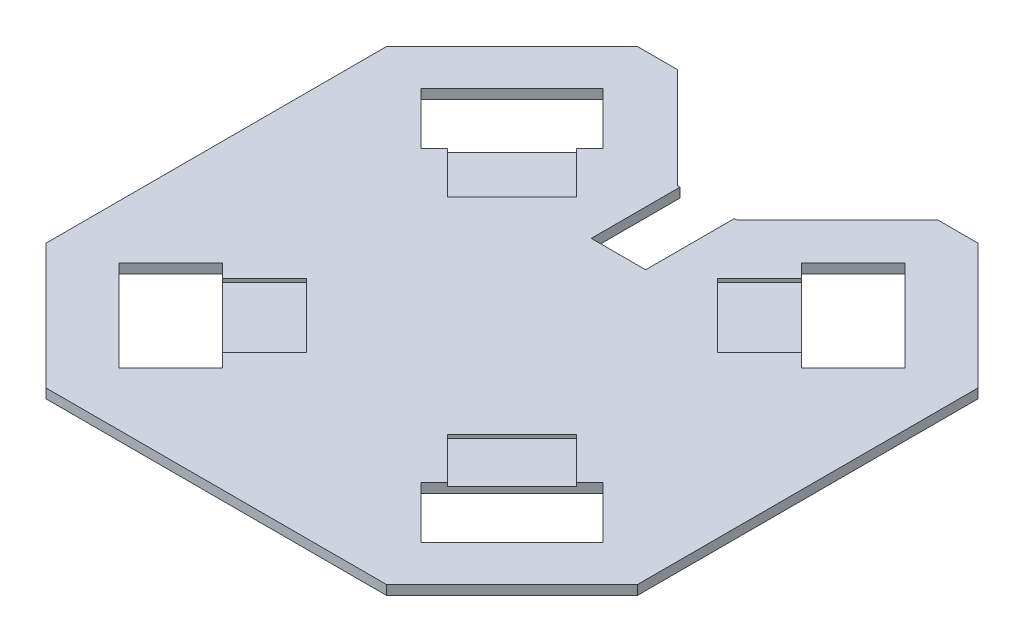
from build123d import *

# Parameters (mm, degrees)
SKETCH_1_W                 = 500
SKETCH_1_H                 = 500
EXTRUDE_1_DEPTH            = 4
CUT_EXTRUDE_819_DEPTH      = 354.643888679
CUT_EXTRUDE_819_DEPTH_BACK = 354.643888679
SKETCH_5_W                 = 46
SKETCH_5_H                 = 160
CUT_EXTRUDE_1518_DEPTH     = 354.643888679
CUT_EXTRUDE_2499_DEPTH     = 354.643888679
CUT_EXTRUDE_3003_DEPTH     = 3
PATTERN_CIRCULAR_1_COUNT   = 4
CHAMFER_1_SIZE             = 106


with BuildPart() as part:
    # 草图1 → 凸台-拉伸1 (new, symmetric)
    with BuildSketch(Plane(origin=(0, 0, 0), x_dir=(1, 0, 0), z_dir=(0, 1, 0))):
        Rectangle(SKETCH_1_W, SKETCH_1_H)
    extrude(amount=EXTRUDE_1_DEPTH, both=True)

    # 草图3 → Cut-Extrude 819 (cut, two sides: drawn at the far end of the back side and taken through both)
    with BuildSketch(Plane(origin=(0, 4, 0), x_dir=(1, 0, 0), z_dir=(0, 1, 0)).offset(-CUT_EXTRUDE_819_DEPTH_BACK)):
        Polygon((988.391904244, 1128.391904244), (110, 250), (25, 165), (-25, 165), (-110, 250), (-988.391904244, 1128.391904244), (-988.391904244, 3612.859392363), (988.391904244, 3612.859392363), align=None)
    extrude(amount=CUT_EXTRUDE_819_DEPTH + CUT_EXTRUDE_819_DEPTH_BACK, mode=Mode.SUBTRACT)

    # 草图5 → Cut-Extrude 1518 (cut, through all)
    with BuildSketch(Plane(origin=(0, 4, 0), x_dir=(1, 0, 0), z_dir=(0, 1, 0))):
        with Locations((0, 170)):
            Rectangle(SKETCH_5_W, SKETCH_5_H)
    extrude(amount=-CUT_EXTRUDE_1518_DEPTH, mode=Mode.SUBTRACT)

    # 草图4 → Cut-Extrude 2499 (cut, through all)
    with BuildSketch(Plane(origin=(0, 4, 0), x_dir=(1, 0, 0), z_dir=(0, 1, 0))):
        Polygon((83.836822653, -160.822123637), (160.822123637, -83.836822653), (204.662744071, -127.677443087), (127.677443087, -204.662744071), align=None)
    cut_extrude_2499 = extrude(amount=-CUT_EXTRUDE_2499_DEPTH, mode=Mode.SUBTRACT)

    # 草图7 → Cut-Extrude 3003 (cut)
    with BuildSketch(Plane(origin=(0, 4, 0), x_dir=(1, 0, 0), z_dir=(0, 1, 0))):
        Polygon((95.10586207, -149.553084221), (59.75052301, -114.197745162), (114.197745162, -59.75052301), (149.553084221, -95.10586207), align=None)
    cut_extrude_3003 = extrude(amount=-CUT_EXTRUDE_3003_DEPTH, mode=Mode.SUBTRACT)

    # 阵列(圆周)1: Cut-Extrude 2499, Cut-Extrude 3003 ×4 about axis
    pattern_circular_1_axis = Axis((0, -11.592383123, 0), (0, 1, 0))
    add([cut_extrude_2499.rotate(pattern_circular_1_axis, i * 360 / PATTERN_CIRCULAR_1_COUNT) for i in range(1, PATTERN_CIRCULAR_1_COUNT)], mode=Mode.SUBTRACT)
    add([cut_extrude_3003.rotate(pattern_circular_1_axis, i * 360 / PATTERN_CIRCULAR_1_COUNT) for i in range(1, PATTERN_CIRCULAR_1_COUNT)], mode=Mode.SUBTRACT)

    # 倒角1
    chamfer_1_edges = [part.edges().sort_by_distance(p)[0] for p in [
        (250, 0, -250),
        (250, 0, 250),
        (-250, 0, 250),
        (-250, 0, -250),
    ]]
    chamfer(chamfer_1_edges, length=CHAMFER_1_SIZE)


solid = part.part
